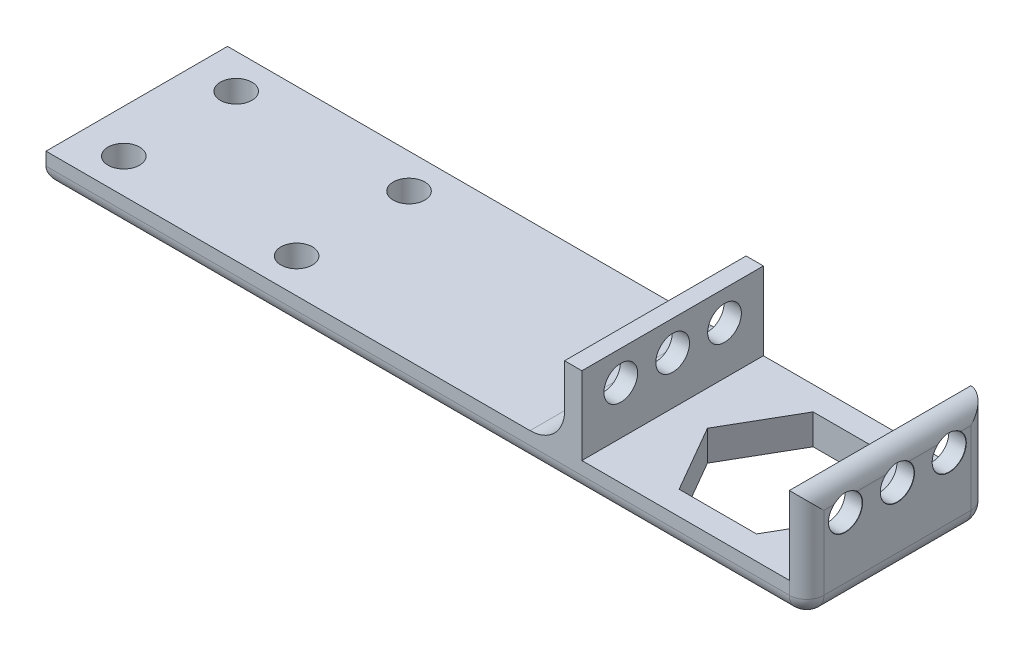
from build123d import *

# Parameters (mm, degrees)
BOSS_EXTRUDE1_DEPTH              = 21
FILLET1_R                        = 4
M3_5_CLEARANCE_HOLE1_D           = 3.9
M3_5_CLEARANCE_HOLE1_CSINK_D     = 3.95
M3_5_CLEARANCE_HOLE1_CSINK_ANGLE = 90
SKETCH4_R                        = 1.825
CUT_EXTRUDE1_DEPTH               = 21
FILLET3_R                        = 2


with BuildPart() as part:
    # Sketch1 → Boss-Extrude1 (new body)
    with BuildSketch(Plane.XY):
        Polygon((12, -20.545429918), (14, -20.545429918), (14, -33.045429918), (-74, -33.045429918), (-74, -29.545429918), (-14, -29.545429918), (-14, -20.545429918), (-12, -20.545429918), (-12, -29.545429918), (12, -29.545429918), align=None)
    extrude(amount=-BOSS_EXTRUDE1_DEPTH)

    # Fillet1
    fillet1_edges = [part.edges().sort_by_distance(p)[0] for p in [
        (-14, -29.545429918, -10.5),
    ]]
    fillet(fillet1_edges, radius=FILLET1_R)

    # M3.5 Clearance Hole1 (through all)
    with Locations(Plane(origin=(14, 0, 0), x_dir=(0, 0, -1), z_dir=(1, 0, 0))):
        with Locations((4.5, -24), (10.5, -24), (16.5, -24)):
            CounterSinkHole(M3_5_CLEARANCE_HOLE1_D / 2, M3_5_CLEARANCE_HOLE1_CSINK_D / 2, counter_sink_angle=M3_5_CLEARANCE_HOLE1_CSINK_ANGLE)

    # Sketch4 → Cut-Extrude1 (cut)
    with BuildSketch(Plane.XZ.offset(33.045429918)):
        with Locations((-69, -4)):
            Circle(SKETCH4_R)
        with Locations((-49, -4)):
            Circle(SKETCH4_R)
        with Locations((18.166214484, -42.778432013)):
            Circle(SKETCH4_R)
        with Locations((28.166214484, -60.098940088)):
            Circle(SKETCH4_R)
        with Locations(Location((-69, -17, 0), (0, 0, 180))):
            Circle(SKETCH4_R)
        with Locations(Location((-49, -17, 0), (0, 0, 180))):
            Circle(SKETCH4_R)
        Polygon((-3.49922334, -18.252792933), (5.452930834, -18.252792933), (9.929007921, -10.5), (5.452930834, -2.747207067), (-3.49922334, -2.747207067), (-7.975300427, -10.5), align=None)
    extrude(amount=-CUT_EXTRUDE1_DEPTH, mode=Mode.SUBTRACT)

    # Fillet3
    # the kernel refuses this fillet: 2 mm, written as the material it takes off along each edge
    with BuildSketch(Plane(origin=(12, -31.045429918, -19), x_dir=(0, 0, -1), z_dir=(0, -1, 0))) as fillet3_piece_1_section:
        Polygon((0, 0), (FILLET3_R, 0), (FILLET3_R, FILLET3_R), (0, FILLET3_R), align=None)
    fillet3_piece_1 = extrude(amount=FILLET3_R, mode=Mode.PRIVATE)
    fillet3_piece_1 = fillet3_piece_1 - Plane(origin=(12, -31.045429918, -19), x_dir=(-0.7071067811865475, 0, 0.7071067811865475), z_dir=(0, -1, 0)) * Sphere(FILLET3_R, mode=Mode.PRIVATE)
    add(fillet3_piece_1, mode=Mode.SUBTRACT)
    with BuildSketch(Plane(origin=(12, -31.045429918, -2), x_dir=(0, -1, 0), z_dir=(0, 0, 1))) as fillet3_piece_2_section:
        Polygon((0, 0), (FILLET3_R, 0), (FILLET3_R, FILLET3_R), (0, FILLET3_R), align=None)
    fillet3_piece_2 = extrude(amount=FILLET3_R, mode=Mode.PRIVATE)
    fillet3_piece_2 = fillet3_piece_2 - Plane(origin=(12, -31.045429918, -2), x_dir=(-0.7071067811865476, 0.7071067811865475, 0), z_dir=(0, 0, 1)) * Sphere(FILLET3_R, mode=Mode.PRIVATE)
    add(fillet3_piece_2, mode=Mode.SUBTRACT)
    with BuildSketch(Plane(origin=(-74, -33.045429918, 5), x_dir=(0, 1, 0), z_dir=(0, 0, -1)), Plane(origin=(14, -20.545429918, 5), x_dir=(0, -1, 0), z_dir=(0, 0, -1))) as fillet3_piece_3:
        with BuildLine():
            CenterArc((FILLET3_R, FILLET3_R), FILLET3_R, 180, 90)
            Line((0, FILLET3_R), (0, 0))
            Line((0, 0), (FILLET3_R, 0))
        make_face()
    extrude(amount=31, mode=Mode.SUBTRACT)
    with BuildSketch(Plane(origin=(12, -33.045429918, -21), x_dir=(0, 1, 0), z_dir=(-1, 0, 0))) as fillet3_piece_4:
        with BuildLine():
            CenterArc((FILLET3_R, -FILLET3_R), FILLET3_R, 90, 90)
            Line((0, -FILLET3_R), (0, 0))
            Line((0, 0), (FILLET3_R, 0))
        make_face()
    extrude(amount=91, mode=Mode.SUBTRACT)
    with BuildSketch(Plane(origin=(12, -33.045429918, 0), x_dir=(0, 1, 0), z_dir=(-1, 0, 0))) as fillet3_piece_5:
        with BuildLine():
            CenterArc((FILLET3_R, FILLET3_R), FILLET3_R, 180, 90)
            Line((0, FILLET3_R), (0, 0))
            Line((0, 0), (FILLET3_R, 0))
        make_face()
    extrude(amount=91, mode=Mode.SUBTRACT)
    with BuildSketch(Plane(origin=(14, -15.545429918, -21), x_dir=(-1, 0, 0), z_dir=(0, -1, 0))) as fillet3_piece_6:
        with BuildLine():
            CenterArc((FILLET3_R, -FILLET3_R), FILLET3_R, 90, 90)
            Line((0, -FILLET3_R), (0, 0))
            Line((0, 0), (FILLET3_R, 0))
        make_face()
    extrude(amount=15.5, mode=Mode.SUBTRACT)
    with BuildSketch(Plane(origin=(14, -15.545429918, 0), x_dir=(-1, 0, 0), z_dir=(0, -1, 0))) as fillet3_piece_7:
        with BuildLine():
            CenterArc((FILLET3_R, FILLET3_R), FILLET3_R, 180, 90)
            Line((0, FILLET3_R), (0, 0))
            Line((0, 0), (FILLET3_R, 0))
        make_face()
    extrude(amount=15.5, mode=Mode.SUBTRACT)
    with BuildSketch(Plane(origin=(14, -33.045429918, -2), x_dir=(-1, 0, 0), z_dir=(0, 0, -1))) as fillet3_piece_8:
        with BuildLine():
            CenterArc((FILLET3_R, FILLET3_R), FILLET3_R, 180, 90)
            Line((0, FILLET3_R), (0, 0))
            Line((0, 0), (FILLET3_R, 0))
        make_face()
    extrude(amount=17, mode=Mode.SUBTRACT)


solid = part.part
